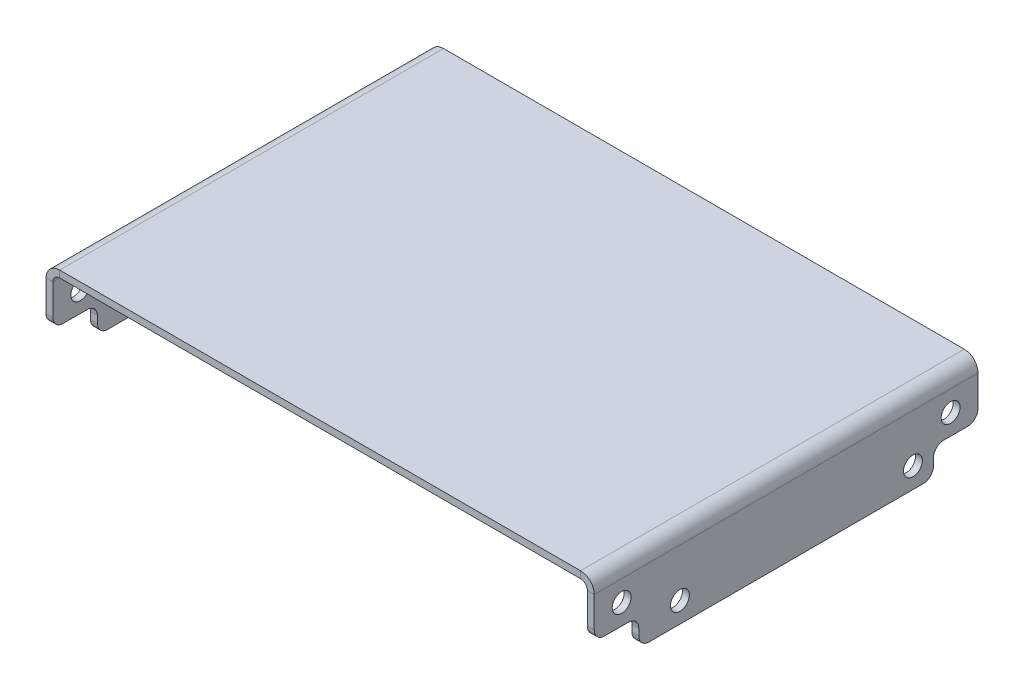
from build123d import *

# Parameters (mm, degrees)
SKETCH1_W                                 = 241.3
SKETCH1_H                                 = 177.8
BASE_FLANGE1_DEPTH                        = 3.175
EDGE_FLANGE1_DEPTH                        = 177.8
EDGE_FLANGE1_BEND_DEPTH                   = 177.8
SKETCH13_W                                = 136.525
SKETCH13_H                                = 12.7
BOSS_EXTRUDE1_DEPTH                       = 3.175
SKETCH39_W                                = 136.525
SKETCH39_H                                = 12.7
BOSS_EXTRUDE2_DEPTH                       = 3.175
HOLE_FOR_1_4_SELF_CLINCHING_NUTS_S_SS_C_D = 8.7376
FILLET2_R                                 = 4.7625


# Sheet-metal steps are written as plain solids
with BuildPart() as part:
    # Sketch1 → Base-Flange1 (new body)
    with BuildSketch(Plane(origin=(0, 0, 0), x_dir=(1, 0, 0), z_dir=(0, 1, 0))):
        Rectangle(SKETCH1_W, SKETCH1_H)
    extrude(amount=-BASE_FLANGE1_DEPTH)

    # Edge-Flange1 section (across the edge) → Edge-Flange1 (add)
    with BuildSketch(Plane(origin=(123.825, -3.175, -88.9), x_dir=(-1, 0, 0), z_dir=(0, 0, 1))):
        with BuildLine():
            Line((-3.175, 3.175), (-3.175, 22.225))
            Line((-3.175, 22.225), (0, 22.225))
            Line((0, 22.225), (0, 3.175))
            ThreePointArc((0, 3.175), (0.92993597, 0.92993597), (3.175, 0))
            Line((3.175, 0), (3.175, -3.175))
            ThreePointArc((3.175, -3.175), (-1.315128061, -1.315128061), (-3.175, 3.175))
        make_face()
    extrude(amount=EDGE_FLANGE1_DEPTH)

    # Edge-Flange1 section 2 (across the edge) → Edge-Flange1 bend (add)
    with BuildSketch(Plane(origin=(-123.825, -3.175, 88.9), x_dir=(1, 0, 0), z_dir=(0, 0, -1))):
        with BuildLine():
            Line((-3.175, 3.175), (-3.175, 22.225))
            Line((-3.175, 22.225), (0, 22.225))
            Line((0, 22.225), (0, 3.175))
            ThreePointArc((0, 3.175), (0.92993597, 0.92993597), (3.175, 0))
            Line((3.175, 0), (3.175, -3.175))
            ThreePointArc((3.175, -3.175), (-1.315128061, -1.315128061), (-3.175, 3.175))
        make_face()
    extrude(amount=EDGE_FLANGE1_BEND_DEPTH)

    # Sketch13 → Boss-Extrude1 (add)
    with BuildSketch(Plane(origin=(127, 0, 0), x_dir=(0, 0, -1), z_dir=(1, 0, 0))):
        with Locations((0, -31.75)):
            Rectangle(SKETCH13_W, SKETCH13_H)
    extrude(amount=-BOSS_EXTRUDE1_DEPTH)

    # Sketch39 → Boss-Extrude2 (add)
    with BuildSketch(Plane.ZY.offset(127)):
        with Locations((0, -31.75)):
            Rectangle(SKETCH39_W, SKETCH39_H)
    extrude(amount=-BOSS_EXTRUDE2_DEPTH)

    # Hole for 1/4 Self-clinching Nuts (S,SS,CLS,CLSS)1 (through all)
    with Locations(Plane(origin=(127, 0, 0), x_dir=(0, 0, -1), z_dir=(1, 0, 0))):
        with Locations((-76.2, -15.875), (76.2, -15.875), (58.7375, -28.575), (-49.2125, -28.575)):
            Hole(HOLE_FOR_1_4_SELF_CLINCHING_NUTS_S_SS_C_D / 2)

    # Fillet2
    fillet2_edges = [part.edges().sort_by_distance(p)[0] for p in [
        (125.4125, -25.4, -88.9),
        (125.4125, -25.4, 88.9),
        (-125.4125, -25.4, 88.9),
        (-125.4125, -25.4, -88.9),
        (125.4125, -38.1, -68.2625),
        (125.4125, -25.4, -68.2625),
        (125.4125, -25.4, 68.2625),
        (125.4125, -38.1, 68.2625),
        (-125.4125, -25.4, -68.2625),
        (-125.4125, -38.1, -68.2625),
        (-125.4125, -38.1, 68.2625),
        (-125.4125, -25.4, 68.2625),
    ]]
    fillet(fillet2_edges, radius=FILLET2_R)


solid = part.part
